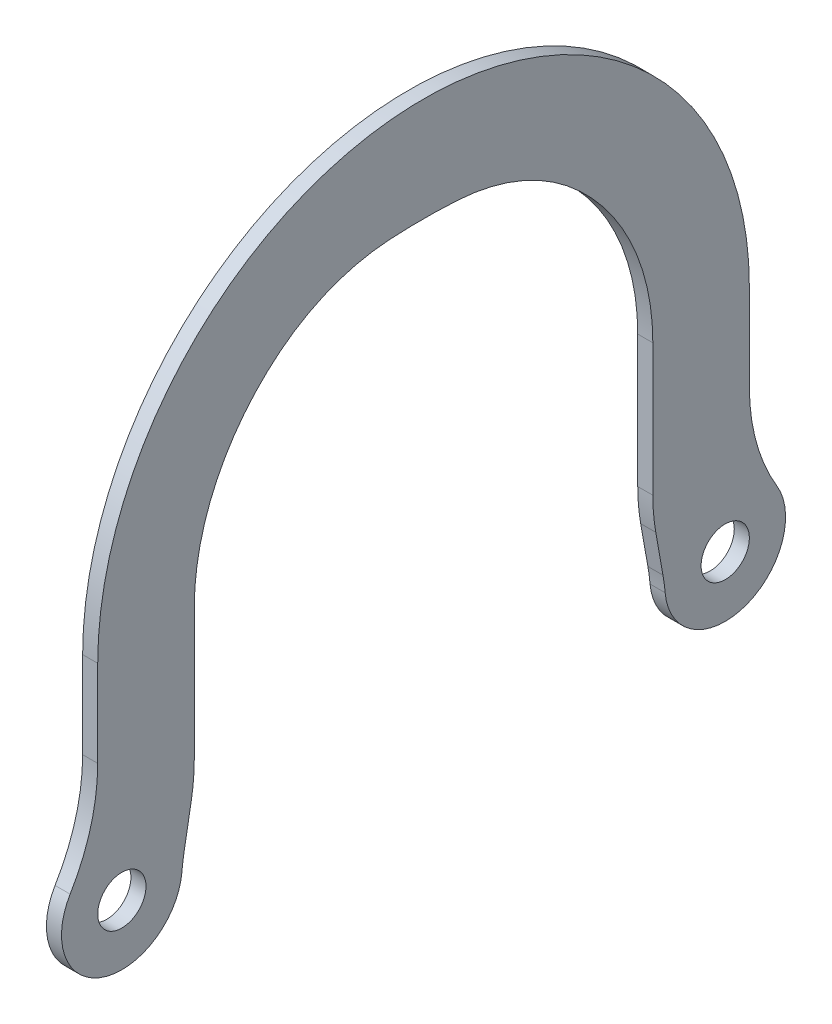
from build123d import *

# Parameters (mm, degrees)
BASE_FLANGE1_DEPTH          = 1.984375
F_1_4_0_25_DIAMETER_HOLE1_D = 6.35
BOSS_EXTRUDE1_DEPTH         = 1.984375
FILLET1_R                   = 25.4
CUT_EXTRUDE1_DEPTH          = 66.291667351
FILLET2_R                   = 25.4


# Sheet-metal steps are written as plain solids
with BuildPart() as part:
    # Sketch2 → Base-Flange1 (new body)
    with BuildSketch(Plane(origin=(0, 0, 0), x_dir=(0, 0, -1), z_dir=(1, 0, 0))):
        with BuildLine():
            Line((30.1625, 0), (30.1625, -28.575))
            ThreePointArc((30.1625, -28.575), (45.186761314, -36.352129933), (42.8625, -19.594743879))
            Line((42.8625, -19.594743879), (42.8625, 0))
            ThreePointArc((42.8625, 0), (0, 42.8625), (-42.8625, 0))
            Line((-42.8625, 0), (-42.8625, -19.594743879))
            ThreePointArc((-42.8625, -19.594743879), (-45.186761314, -36.352129933), (-30.1625, -28.575))
            Line((-30.1625, -28.575), (-30.1625, 0))
            ThreePointArc((-30.1625, 0), (0, 30.1625), (30.1625, 0))
        make_face()
    extrude(amount=-BASE_FLANGE1_DEPTH)

    # 1/4 (0.25) Diameter Hole1 (through all)
    with Locations(Plane(origin=(0, 0, 0), x_dir=(0, 0, -1), z_dir=(1, 0, 0))):
        with Locations((-39.6875, -28.575), (39.6875, -28.575)):
            Hole(F_1_4_0_25_DIAMETER_HOLE1_D / 2)

    # Sketch10 → Boss-Extrude1 (add)
    with BuildSketch(Plane(origin=(0, 0, 0), x_dir=(0, 0, -1), z_dir=(1, 0, 0))):
        with BuildLine():
            ThreePointArc((9.656385517, 28.575), (0, 30.1625), (-9.656385517, 28.575))
            ThreePointArc((-9.656385517, 28.575), (0, 29.207811784), (9.656385517, 28.575))
        make_face()
    extrude(amount=-BOSS_EXTRUDE1_DEPTH)

    # Fillet1
    fillet1_edges = [part.edges().sort_by_distance(p)[0] for p in [
        (-0.9921875, 28.575, 9.656385517),
        (-0.9921875, 28.575, -9.656385517),
    ]]
    fillet(fillet1_edges, radius=FILLET1_R)

    # Sketch11 → Cut-Extrude1 (cut, through all)
    with BuildSketch(Plane(origin=(0, 0, 0), x_dir=(0, 0, -1), z_dir=(1, 0, 0))):
        with BuildLine():
            Line((-42.8625, -21.300161084), (-42.8625, -19.594743879))
            ThreePointArc((-42.8625, -19.594743879), (-45.186761314, -36.352129933), (-30.1625, -28.575))
            Line((-30.1625, -28.575), (-30.1625, -19.594743879))
            Line((-30.1625, -19.594743879), (-31.75, -28.575))
            ThreePointArc((-31.75, -28.575), (-44.0350478, -35.215988961), (-42.8625, -21.300161084))
        make_face()
        with BuildLine():
            ThreePointArc((30.1625, -28.575), (45.186761314, -36.352129933), (42.8625, -19.594743879))
            Line((42.8625, -19.594743879), (42.8625, -21.300161084))
            ThreePointArc((42.8625, -21.300161084), (46.328488961, -24.2274522), (47.625, -28.575))
            ThreePointArc((47.625, -28.575), (39.6875, -36.5125), (31.75, -28.575))
            Line((31.75, -28.575), (30.1625, -19.594743879))
            Line((30.1625, -19.594743879), (30.1625, -28.575))
        make_face()
    extrude(amount=-CUT_EXTRUDE1_DEPTH, mode=Mode.SUBTRACT)

    # Fillet2
    fillet2_edges = [part.edges().sort_by_distance(p)[0] for p in [
        (-0.9921875, -21.300161084, 42.8625),
        (-0.9921875, -28.575, 31.75),
        (-0.9921875, -19.594743879, 30.1625),
        (-0.9921875, -28.575, -31.75),
        (-0.9921875, -21.300161084, -42.8625),
        (-0.9921875, -19.594743879, -30.1625),
    ]]
    fillet(fillet2_edges, radius=FILLET2_R)


solid = part.part
